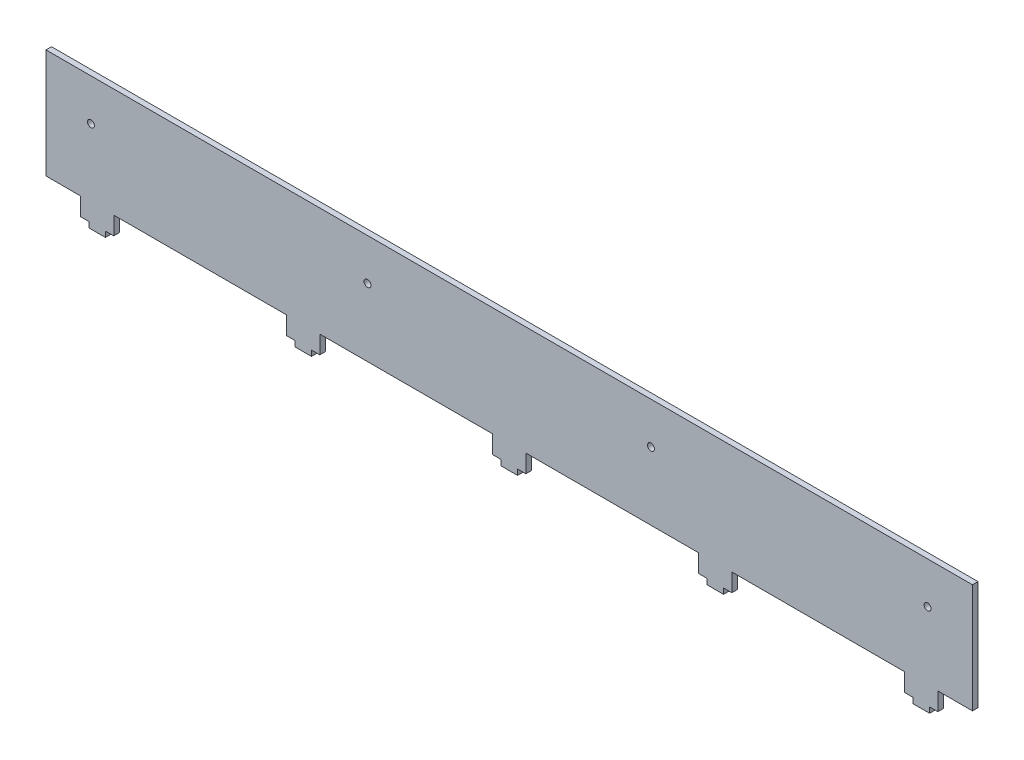
from build123d import *

# Parameters (mm, degrees)
SKETCH_1_W          = 670
SKETCH_1_H          = 92
EXTRUDE_1_DEPTH     = 2
SKETCH_2_W          = 125
SKETCH_2_H          = 13
CUT_EXTRUDE_1_DEPTH = 339.167118449
SKETCH_5_R          = 2.5
CUT_EXTRUDE_4_DEPTH = 339.167118449
SKETCH_6_W          = 12
SKETCH_6_H          = 4
EXTRUDE_2_DEPTH     = 4


with BuildPart() as part:
    # Эскиз1 → Бобышка-Вытянуть1 (new, symmetric)
    with BuildSketch(Plane.XY):
        Rectangle(SKETCH_1_W, SKETCH_1_H)
    extrude(amount=EXTRUDE_1_DEPTH, both=True)

    # Эскиз2 → Вырез-Вытянуть1 (cut, through all)
    with BuildSketch(Plane.XY.offset(2)):
        with Locations((-372.5, -39.5)):
            Rectangle(SKETCH_2_W, SKETCH_2_H)
        with Locations((-223.5, -39.5)):
            Rectangle(SKETCH_2_W, SKETCH_2_H)
        with Locations((-74.5, -39.5)):
            Rectangle(SKETCH_2_W, SKETCH_2_H)
        with Locations((74.5, -39.5)):
            Rectangle(SKETCH_2_W, SKETCH_2_H)
        with Locations((223.5, -39.5)):
            Rectangle(SKETCH_2_W, SKETCH_2_H)
        with Locations((372.5, -39.5)):
            Rectangle(SKETCH_2_W, SKETCH_2_H)
    extrude(amount=-CUT_EXTRUDE_1_DEPTH, mode=Mode.SUBTRACT)

    # Эскиз5 → Вырез-Вытянуть4 (cut, through all)
    with BuildSketch(Plane.XY.offset(2)):
        with Locations((-102.5, 16)):
            Circle(SKETCH_5_R)
        with Locations((102.5, 16)):
            Circle(SKETCH_5_R)
        with Locations((-302.5, 16)):
            Circle(SKETCH_5_R)
        with Locations((302.5, 16)):
            Circle(SKETCH_5_R)
    extrude(amount=-CUT_EXTRUDE_4_DEPTH, mode=Mode.SUBTRACT)

    # Эскиз6 → Бобышка-Вытянуть2 (add)
    with BuildSketch(Plane.XZ.offset(46)):
        with Locations((298, 0)):
            Rectangle(SKETCH_6_W, SKETCH_6_H)
        with Locations((149, 0)):
            Rectangle(SKETCH_6_W, SKETCH_6_H)
        Rectangle(SKETCH_6_W, SKETCH_6_H)
        with Locations((-149, 0)):
            Rectangle(SKETCH_6_W, SKETCH_6_H)
        with Locations((-298, 0)):
            Rectangle(SKETCH_6_W, SKETCH_6_H)
    extrude(amount=EXTRUDE_2_DEPTH)


solid = part.part
